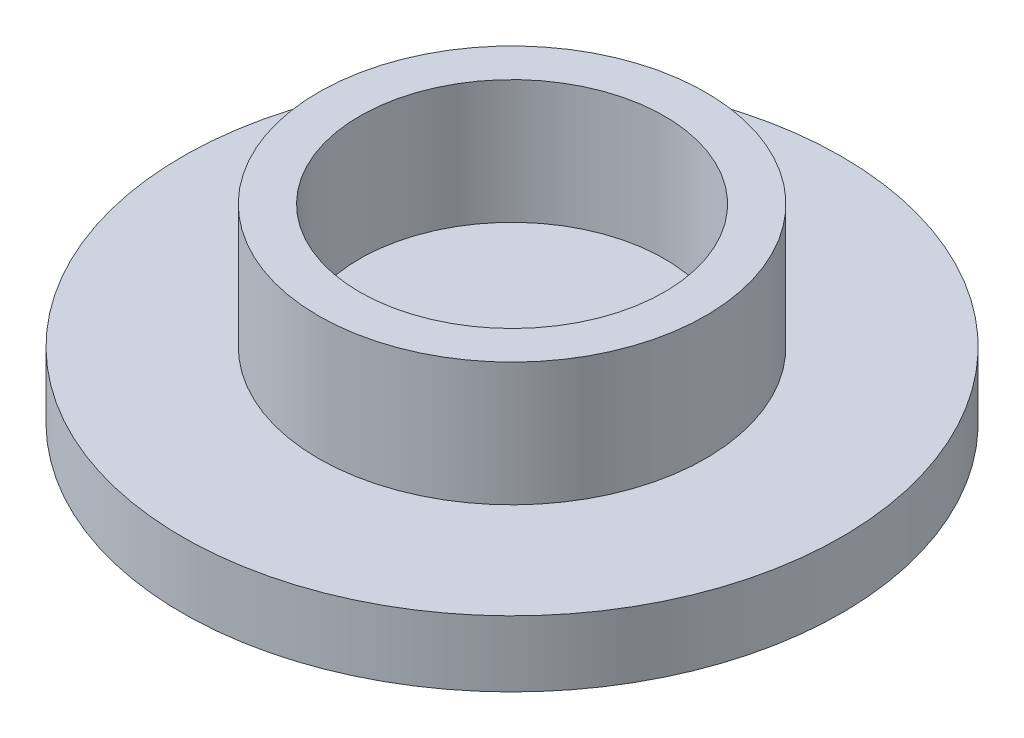
from build123d import *

# Parameters (mm, degrees)
SKETCH1_R           = 2.35
SKETCH1_R_2         = 1.85
BOSS_EXTRUDE1_DEPTH = 1.5
SKETCH2_R           = 4
BOSS_EXTRUDE2_DEPTH = 0.8


with BuildPart() as part:
    # Sketch1 → Boss-Extrude1 (new body)
    with BuildSketch(Plane(origin=(0, 0, 0), x_dir=(1, 0, 0), z_dir=(0, 1, 0))):
        Circle(SKETCH1_R)
        Circle(SKETCH1_R_2, mode=Mode.SUBTRACT)
    extrude(amount=BOSS_EXTRUDE1_DEPTH)

    # Sketch2 → Boss-Extrude2 (add)
    with BuildSketch(Plane.XZ):
        Circle(SKETCH2_R)
    extrude(amount=BOSS_EXTRUDE2_DEPTH)


solid = part.part
